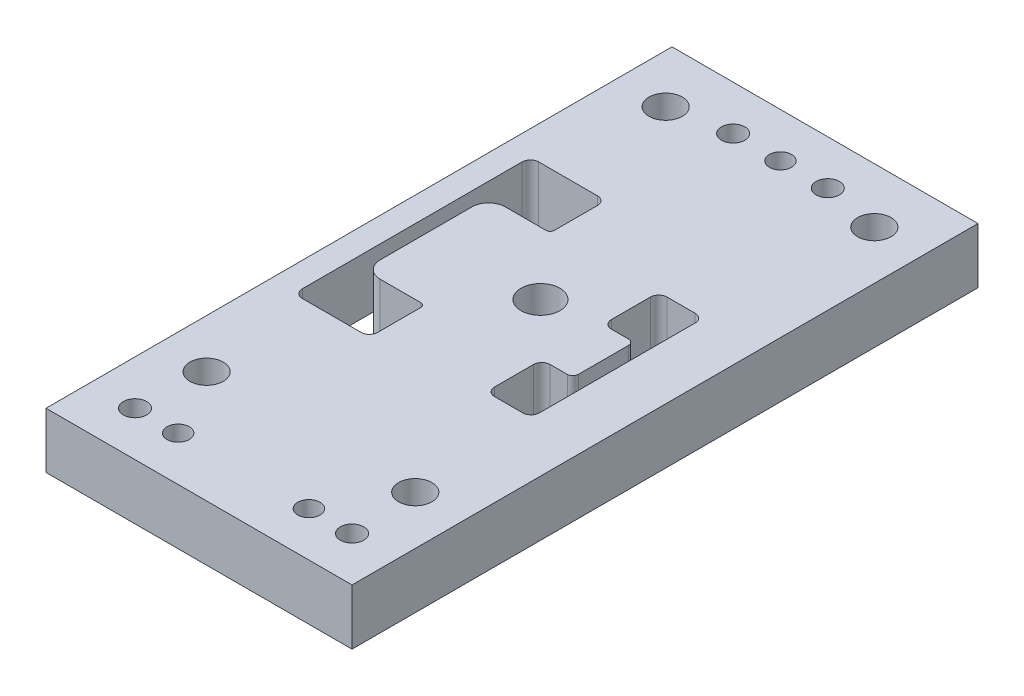
from build123d import *

# Parameters (mm, degrees)
SKETCH1_W                                           = 110
SKETCH1_H                                           = 225
BOSS_EXTRUDE1_DEPTH                                 = 20
CUT_EXTRUDE1_REACH                                  = 128.812
CUT_EXTRUDE2_REACH                                  = 128.812
SKETCH4_R                                           = 10.5
CUT_EXTRUDE3_DEPTH                                  = 14.2
CUT_EXTRUDE4_REACH                                  = 128.812
SKETCH5_R                                           = 6
CUT_EXTRUDE5_REACH                                  = 128.812
SKETCH6_R                                           = 7
CBORE_FOR_M8_HEX_SOCKET_HEAD_CAP_SCREW1_D           = 8.4
CBORE_FOR_M8_HEX_SOCKET_HEAD_CAP_SCREW1_CBORE_D     = 15
CBORE_FOR_M8_HEX_SOCKET_HEAD_CAP_SCREW1_CBORE_DEPTH = 8.6
F_8_0MM_DOWEL_HOLE1_D                               = 8


with BuildPart() as part:
    # Sketch1 → Boss-Extrude1 (new body)
    with BuildSketch(Plane(origin=(0, 0, 0), x_dir=(1, 0, 0), z_dir=(0, 1, 0))):
        Rectangle(SKETCH1_W, SKETCH1_H)
    extrude(amount=BOSS_EXTRUDE1_DEPTH)

    # Sketch2 → Cut-Extrude1 (cut, up to next)
    with BuildSketch(Plane(origin=(0, 20, 0), x_dir=(1, 0, 0), z_dir=(0, 1, 0)), mode=Mode.PRIVATE) as cut_extrude1_sk1:
        with BuildLine():
            Line((-43.12, -32.27), (-22, -32.27))
            ThreePointArc((-22, -32.27), (-19.878679656, -31.391320344), (-19, -29.27))
            Line((-19, -29.27), (-19, -13.77))
            ThreePointArc((-19, -13.77), (-19.439339828, -12.709339828), (-20.5, -12.27))
            Line((-20.5, -12.27), (-35.12, -12.27))
            ThreePointArc((-35.12, -12.27), (-39.362640687, -10.512640687), (-41.12, -6.27))
            Line((-41.12, -6.27), (-41.12, 26.73))
            ThreePointArc((-41.12, 26.73), (-39.362640687, 30.972640687), (-35.12, 32.73))
            Line((-35.12, 32.73), (-20.5, 32.73))
            ThreePointArc((-20.5, 32.73), (-19.439339828, 33.169339828), (-19, 34.23))
            Line((-19, 34.23), (-19, 49.73))
            ThreePointArc((-19, 49.73), (-19.878679656, 51.851320344), (-22, 52.73))
            Line((-22, 52.73), (-43.12, 52.73))
            ThreePointArc((-43.12, 52.73), (-45.241320344, 51.851320344), (-46.12, 49.73))
            Line((-46.12, 49.73), (-46.12, -29.27))
            ThreePointArc((-46.12, -29.27), (-45.241320344, -31.391320344), (-43.12, -32.27))
        make_face()
    cut_extrude1_tool1 = extrude(cut_extrude1_sk1.sketch, amount=-CUT_EXTRUDE1_REACH, mode=Mode.PRIVATE) & part.part
    add(cut_extrude1_tool1.solids().sort_by_distance((-32.56, 20, 31.377784))[0], mode=Mode.SUBTRACT)

    # Sketch3 → Cut-Extrude2 (cut, up to next)
    with BuildSketch(Plane(origin=(0, 20, 0), x_dir=(1, 0, 0), z_dir=(0, 1, 0)), mode=Mode.PRIVATE) as cut_extrude2_sk1:
        with BuildLine():
            Line((22, -8.27), (28.13, -8.27))
            ThreePointArc((28.13, -8.27), (29.544213562, -7.684213562), (30.13, -6.27))
            Line((30.13, -6.27), (30.13, 11.73))
            ThreePointArc((30.13, 11.73), (29.544213562, 13.144213562), (28.13, 13.73))
            Line((28.13, 13.73), (22, 13.73))
            ThreePointArc((22, 13.73), (19.878679656, 14.608679656), (19, 16.73))
            Line((19, 16.73), (19, 30.73))
            ThreePointArc((19, 30.73), (19.878679656, 32.851320344), (22, 33.73))
            Line((22, 33.73), (32.13, 33.73))
            ThreePointArc((32.13, 33.73), (34.251320344, 32.851320344), (35.13, 30.73))
            Line((35.13, 30.73), (35.13, -25.27))
            ThreePointArc((35.13, -25.27), (34.251320344, -27.391320344), (32.13, -28.27))
            Line((32.13, -28.27), (22, -28.27))
            ThreePointArc((22, -28.27), (19.878679656, -27.391320344), (19, -25.27))
            Line((19, -25.27), (19, -11.27))
            ThreePointArc((19, -11.27), (19.878679656, -9.148679656), (22, -8.27))
        make_face()
    cut_extrude2_tool1 = extrude(cut_extrude2_sk1.sketch, amount=-CUT_EXTRUDE2_REACH, mode=Mode.PRIVATE) & part.part
    add(cut_extrude2_tool1.solids().sort_by_distance((27.065, 20, 27.629361))[0], mode=Mode.SUBTRACT)

    # Sketch4 → Cut-Extrude3 (cut)
    with BuildSketch(Plane.XZ):
        with Locations((37.5, 52.27)):
            Circle(SKETCH4_R)
        with Locations((12.5, 52.27)):
            Circle(SKETCH4_R)
        with Locations((-12.5, 52.27)):
            Circle(SKETCH4_R)
        with Locations((-37.5, 52.27)):
            Circle(SKETCH4_R)
        with Locations((0, 9.77)):
            Circle(SKETCH4_R)
        with Locations((0, -30.23)):
            Circle(SKETCH4_R)
        with Locations((37.5, -72.73)):
            Circle(SKETCH4_R)
        with Locations((12.5, -72.73)):
            Circle(SKETCH4_R)
        with Locations((-12.5, -72.73)):
            Circle(SKETCH4_R)
        with Locations((-37.5, -72.73)):
            Circle(SKETCH4_R)
    extrude(amount=-CUT_EXTRUDE3_DEPTH, mode=Mode.SUBTRACT)

    # Sketch5 → Cut-Extrude4 (cut, up to next)
    with BuildSketch(Plane(origin=(0, 20, 0), x_dir=(1, 0, 0), z_dir=(0, 1, 0)), mode=Mode.PRIVATE) as cut_extrude4_sk1:
        with Locations((-37.5, 92.73)):
            Circle(SKETCH5_R)
    cut_extrude4_tool1 = extrude(cut_extrude4_sk1.sketch, amount=-CUT_EXTRUDE4_REACH, mode=Mode.PRIVATE) & part.part
    # Sketch5 → Cut-Extrude4 (cut, up to next)
    with BuildSketch(Plane(origin=(0, 20, 0), x_dir=(1, 0, 0), z_dir=(0, 1, 0)), mode=Mode.PRIVATE) as cut_extrude4_sk2:
        with Locations((37.5, 92.73)):
            Circle(SKETCH5_R)
    cut_extrude4_tool2 = extrude(cut_extrude4_sk2.sketch, amount=-CUT_EXTRUDE4_REACH, mode=Mode.PRIVATE) & part.part
    # Sketch5 → Cut-Extrude4 (cut, up to next)
    with BuildSketch(Plane(origin=(0, 20, 0), x_dir=(1, 0, 0), z_dir=(0, 1, 0)), mode=Mode.PRIVATE) as cut_extrude4_sk3:
        with Locations((-37.5, -72.27)):
            Circle(SKETCH5_R)
    cut_extrude4_tool3 = extrude(cut_extrude4_sk3.sketch, amount=-CUT_EXTRUDE4_REACH, mode=Mode.PRIVATE) & part.part
    # Sketch5 → Cut-Extrude4 (cut, up to next)
    with BuildSketch(Plane(origin=(0, 20, 0), x_dir=(1, 0, 0), z_dir=(0, 1, 0)), mode=Mode.PRIVATE) as cut_extrude4_sk4:
        with Locations((37.5, -72.27)):
            Circle(SKETCH5_R)
    cut_extrude4_tool4 = extrude(cut_extrude4_sk4.sketch, amount=-CUT_EXTRUDE4_REACH, mode=Mode.PRIVATE) & part.part
    add(cut_extrude4_tool1.solids().sort_by_distance((-37.5, 20, -92.73))[0], mode=Mode.SUBTRACT)
    add(cut_extrude4_tool2.solids().sort_by_distance((37.5, 20, -92.73))[0], mode=Mode.SUBTRACT)
    add(cut_extrude4_tool3.solids().sort_by_distance((-37.5, 20, 72.27))[0], mode=Mode.SUBTRACT)
    add(cut_extrude4_tool4.solids().sort_by_distance((37.5, 20, 72.27))[0], mode=Mode.SUBTRACT)

    # Sketch6 → Cut-Extrude5 (cut, up to next)
    with BuildSketch(Plane(origin=(0, 20, 0), x_dir=(1, 0, 0), z_dir=(0, 1, 0)), mode=Mode.PRIVATE) as cut_extrude5_sk1:
        with Locations((0, 10.23)):
            Circle(SKETCH6_R)
    cut_extrude5_tool1 = extrude(cut_extrude5_sk1.sketch, amount=-CUT_EXTRUDE5_REACH, mode=Mode.PRIVATE) & part.part
    add(cut_extrude5_tool1.solids().sort_by_distance((0, 20, -10.23))[0], mode=Mode.SUBTRACT)

    # CBORE for M8 Hex Socket Head Cap Screw1 (through all)
    with Locations(Plane(origin=(0, 0, 0), x_dir=(-1, 0, 0), z_dir=(0, -1, 0))):
        with Locations((-17, 96.5), (17, 96.5), (-39, -96.5), (39, -96.5)):
            CounterBoreHole(CBORE_FOR_M8_HEX_SOCKET_HEAD_CAP_SCREW1_D / 2, CBORE_FOR_M8_HEX_SOCKET_HEAD_CAP_SCREW1_CBORE_D / 2, CBORE_FOR_M8_HEX_SOCKET_HEAD_CAP_SCREW1_CBORE_DEPTH)

    # Ø8.0mm Dowel Hole1 (through all)
    with Locations(Plane(origin=(0, 0, 0), x_dir=(-1, 0, 0), z_dir=(0, -1, 0))):
        with Locations((0, 96.5), (-23.5, -96.5), (23.5, -96.5)):
            Hole(F_8_0MM_DOWEL_HOLE1_D / 2)


solid = part.part
